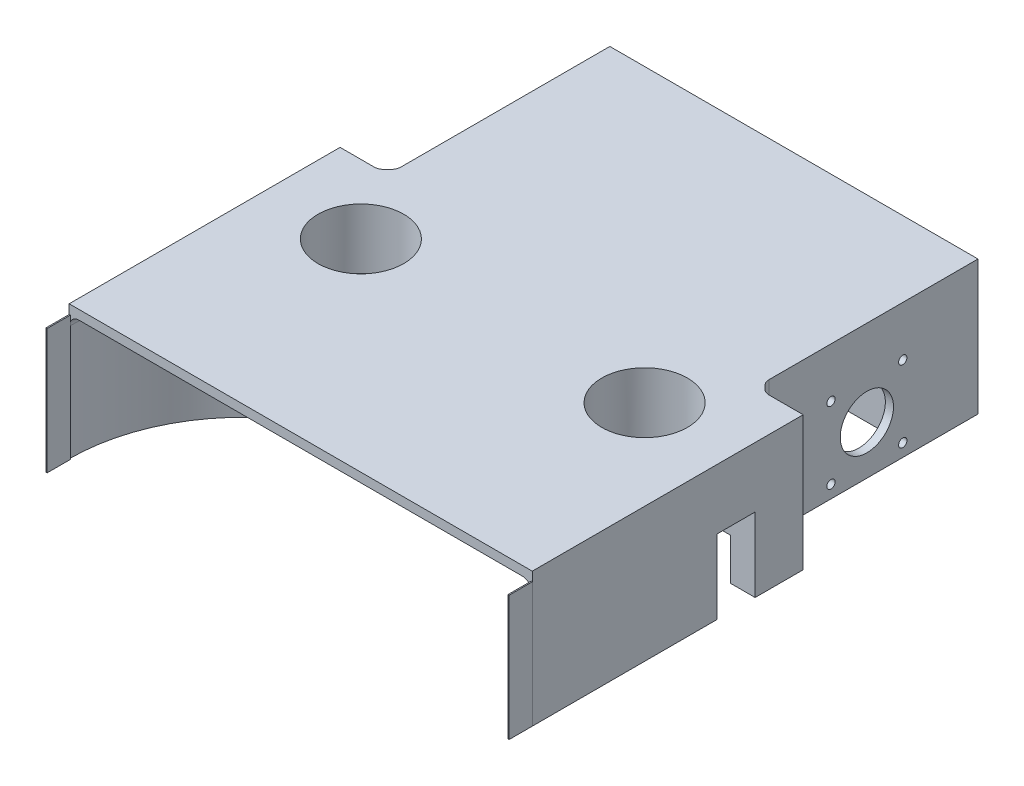
from build123d import *

# Parameters (mm, degrees)
SKETCH_1_W              = 200
SKETCH_1_H              = 213
EXTRUDE_1_DEPTH         = 4
EXTRUDE_2_DEPTH         = 54
SKETCH_1_5_W            = 0.5
SKETCH_1_5_H            = 10
EXTRUDE_3_DEPTH         = 54
EXTRUDE_3_2_DEPTH       = 54
CUT_EXTRUDE_2_DEPTH     = 298.880848663
CUT_EXTRUDE_3_DEPTH     = 42
SKETCH_7_R              = 1.8
SKETCH_7_R_2            = 11.5
CUT_EXTRUDE_4_DEPTH     = 282.53330176
MIRROR_START            = 176
MIRROR_1_OUTLINE_R      = 1.8
MIRROR_1_OUTLINE_R_2    = 11.5
MIRROR_1_DEPTH          = 3.5
CUT_EXTRUDE_START       = -21
CUT_EXTRUDE_5_OUTLINE_W = 27
CUT_EXTRUDE_5_OUTLINE_H = 20
CUT_EXTRUDE_5_DEPTH     = 21
CUT_EXTRUDE_START_2     = -6
CUT_EXTRUDE_6_OUTLINE_W = 27
CUT_EXTRUDE_6_OUTLINE_H = 28
CUT_EXTRUDE_6_DEPTH     = 6
SKETCH_11_R             = 34
CUT_EXTRUDE_7_DEPTH     = 18
CUT_EXTRUDE_8_DEPTH     = 32
SKETCH_15_R             = 18.5
CUT_EXTRUDE_11_DEPTH    = 26
SKETCH_17_R             = 1.5
CUT_EXTRUDE_14_DEPTH    = 295.905069472
CHAMFER_1_SIZE          = 4
FILLET_3_R              = 4.4


# Read off the part's stored shape, not the designer's step: 镜向1, 切除-拉伸5, 切除-拉伸6
with BuildPart() as part:
    # 草图1 → 凸台-拉伸1 (new body)
    with BuildSketch(Plane(origin=(0, 0, 0), x_dir=(1, 0, 0), z_dir=(0, 1, 0))):
        with Locations((100, 106.5)):
            Rectangle(SKETCH_1_W, SKETCH_1_H)
    extrude(amount=EXTRUDE_1_DEPTH)

    # 草图1<4> → 凸台-拉伸2 (add)
    with BuildSketch(Plane(origin=(0, 0, 0), x_dir=(1, 0, 0), z_dir=(0, 1, 0))):
        with BuildLine():
            Line((0, 213), (0, 0))
            ThreePointArc((0, 0), (21.966991411, 53.033008589), (75, 75))
            Line((75, 75), (75, 213))
            Line((75, 213), (0, 213))
        make_face()
        with BuildLine():
            Line((125, 213), (125, 75))
            ThreePointArc((125, 75), (178.033008589, 53.033008589), (200, 0))
            Line((200, 0), (200, 213))
            Line((200, 213), (125, 213))
        make_face()
    extrude(amount=-EXTRUDE_2_DEPTH)

    # 草图3 → 切除-拉伸2 (cut, through all)
    with BuildSketch(Plane.XZ.offset(54)):
        Polygon((20.5, -186), (20.5, -165), (20.5, -144), (20.5, -117), (0, -117), (0, -213), (20.5, -213), align=None)
        Polygon((179.5, -117), (200, -117), (200, -213), (179.5, -213), (179.5, -165), align=None)
    extrude(amount=-CUT_EXTRUDE_2_DEPTH, mode=Mode.SUBTRACT)

    # 草图5 → 切除-拉伸3 (cut)
    with BuildSketch(Plane.XZ.offset(54)):
        Polygon((176, -165), (176, -144), (125, -144), (125, -186), (176, -186), align=None)
        Polygon((24, -165), (24, -144), (75, -144), (75, -186), (24, -186), align=None)
    extrude(amount=-CUT_EXTRUDE_3_DEPTH, mode=Mode.SUBTRACT)

    # 草图7 → 切除-拉伸4 (cut, through all)
    with BuildSketch(Plane(origin=(24, 0, 0), x_dir=(0, 0, -1), z_dir=(1, 0, 0))):
        with Locations((180.5, -17.5)):
            Circle(SKETCH_7_R)
        with Locations((149.5, -17.5)):
            Circle(SKETCH_7_R)
        with Locations((165, -33)):
            Circle(SKETCH_7_R_2)
        with Locations((180.5, -48.5)):
            Circle(SKETCH_7_R)
        with Locations((149.5, -48.5)):
            Circle(SKETCH_7_R)
    extrude(amount=-CUT_EXTRUDE_4_DEPTH, mode=Mode.SUBTRACT)

    # 镜向1 outline → 镜向1 (cut)
    with BuildSketch(Plane.YZ.offset(MIRROR_START)):
        with Locations((-17.5, -180.5)):
            Circle(MIRROR_1_OUTLINE_R)
        with Locations((-17.5, -149.5)):
            Circle(MIRROR_1_OUTLINE_R)
        with Locations((-33, -165)):
            Circle(MIRROR_1_OUTLINE_R_2)
        with Locations((-48.5, -180.5)):
            Circle(MIRROR_1_OUTLINE_R)
        with Locations((-48.5, -149.5)):
            Circle(MIRROR_1_OUTLINE_R)
    extrude(amount=MIRROR_1_DEPTH, mode=Mode.SUBTRACT)

    # 切除-拉伸5 outline → 切除-拉伸5 (cut)
    with BuildSketch(Plane(origin=(75, 0, 0), x_dir=(0, 0, -1), z_dir=(1, 0, 0)).offset(CUT_EXTRUDE_START)):
        with Locations((199.5, -33)):
            Rectangle(CUT_EXTRUDE_5_OUTLINE_W, CUT_EXTRUDE_5_OUTLINE_H)
    extrude(amount=CUT_EXTRUDE_5_DEPTH, mode=Mode.SUBTRACT)

    # 切除-拉伸6 outline → 切除-拉伸6 (cut)
    with BuildSketch(Plane.ZY.offset(-125).offset(CUT_EXTRUDE_START_2)):
        with Locations((-199.5, -33)):
            Rectangle(CUT_EXTRUDE_6_OUTLINE_W, CUT_EXTRUDE_6_OUTLINE_H)
    extrude(amount=CUT_EXTRUDE_6_DEPTH, mode=Mode.SUBTRACT)

    # 草图11 → 切除-拉伸7 (cut)
    with BuildSketch(Plane.XZ.offset(54)):
        with Locations((43.588095895, -88.0112367)):
            Circle(SKETCH_11_R)
        with Locations((156.411904105, -88.0112367)):
            Circle(SKETCH_11_R)
    extrude(amount=-CUT_EXTRUDE_7_DEPTH, mode=Mode.SUBTRACT)

    # 草图12 → 切除-拉伸8 (cut)
    with BuildSketch(Plane.XZ.offset(54)):
        with BuildLine():
            Line((43.588095895, -79.776603565), (0, -79.776603565))
            Line((0, -79.776603565), (0, -96.245869836))
            Line((0, -96.245869836), (43.588095895, -96.245869836))
            ThreePointArc((43.588095895, -96.245869836), (51.82272903, -88.0112367), (43.588095895, -79.776603565))
        make_face()
        with BuildLine():
            Line((200, -79.776603565), (200, -96.245869836))
            Line((200, -96.245869836), (156.411904105, -96.245869836))
            ThreePointArc((156.411904105, -96.245869836), (148.17727097, -88.0112367), (156.411904105, -79.776603565))
            Line((156.411904105, -79.776603565), (200, -79.776603565))
        make_face()
    extrude(amount=-CUT_EXTRUDE_8_DEPTH, mode=Mode.SUBTRACT)

    # 草图15 → 切除-拉伸11 (cut)
    with BuildSketch(Plane(origin=(0, 4, 0), x_dir=(1, 0, 0), z_dir=(0, 1, 0))):
        with Locations(Location((38.73585496, 87.245869836, 0), (0, 0, 270))):
            Circle(SKETCH_15_R)
        with Locations(Location((161.26414504, 87.245869836, 0), (0, 0, 336.187548677))):
            Circle(SKETCH_15_R)
    extrude(amount=-CUT_EXTRUDE_11_DEPTH, mode=Mode.SUBTRACT)

    # 草图17 → 切除-拉伸14 (cut, through all)
    with BuildSketch(Plane.XZ.offset(36)):
        with Locations((25.312461201, -79.495869836)):
            Circle(SKETCH_17_R)
        with Locations(Location((38.73585496, -71.745869836, 0), (0, 0, 270))):
            Circle(SKETCH_17_R)
        with Locations(Location((52.159248718, -79.495869836, 0), (0, 0, 270))):
            Circle(SKETCH_17_R)
        with Locations(Location((52.159248718, -94.995869836, 0), (0, 0, 270))):
            Circle(SKETCH_17_R)
        with Locations(Location((38.73585496, -102.745869836, 0), (0, 0, 270))):
            Circle(SKETCH_17_R)
        with Locations((25.312461201, -94.995869836)):
            Circle(SKETCH_17_R)
        with Locations((174.687538799, -94.995869836)):
            Circle(SKETCH_17_R)
        with Locations(Location((161.26414504, -102.745869836, 0), (0, 0, 270))):
            Circle(SKETCH_17_R)
        with Locations(Location((147.840751282, -94.995869836, 0), (0, 0, 270))):
            Circle(SKETCH_17_R)
        with Locations(Location((147.840751282, -79.495869836, 0), (0, 0, 270))):
            Circle(SKETCH_17_R)
        with Locations(Location((161.26414504, -71.745869836, 0), (0, 0, 270))):
            Circle(SKETCH_17_R)
        with Locations((174.687538799, -79.495869836)):
            Circle(SKETCH_17_R)
    extrude(amount=-CUT_EXTRUDE_14_DEPTH, mode=Mode.SUBTRACT)

    # 倒角1
    chamfer_1_edges = [part.edges().sort_by_distance(p)[0] for p in [
        (20.5, -25, -117),
        (179.5, -25, -117),
    ]]
    chamfer(chamfer_1_edges, length=CHAMFER_1_SIZE)

    # 圆角3
    fillet_3_edges = [part.edges().sort_by_distance(p)[0] for p in [
        (125, -18, -75),
        (125, -45, -101.022473401),
        (75, -18, -75),
        (27.512880617, -45, -58.051472787),
        (75, -45, -101.022473401),
        (172.487119383, -45, -58.051472787),
        (21.966991411, 0, -53.033008589),
        (75, 0, -144),
        (178.033008589, 0, -53.033008589),
        (125, 0, -144),
        (16.5, -25, -117),
        (20.5, -25, -121),
        (179.5, -25, -121),
        (183.5, -25, -117),
    ]]
    fillet(fillet_3_edges, radius=FILLET_3_R)


with BuildPart() as body_2:
    # 草图1<5> → 凸台-拉伸3 (new body)
    with BuildSketch(Plane(origin=(0, 0, 0), x_dir=(1, 0, 0), z_dir=(0, 1, 0))):
        with Locations((199.75, -5)):
            Rectangle(SKETCH_1_5_W, SKETCH_1_5_H)
    extrude(amount=-EXTRUDE_3_DEPTH)


with BuildPart() as body_3:
    # 草图1<5> → Extrude 3 2 (new body)
    with BuildSketch(Plane(origin=(0, 0, 0), x_dir=(1, 0, 0), z_dir=(0, 1, 0))):
        with Locations((0.25, -5)):
            Rectangle(SKETCH_1_5_W, SKETCH_1_5_H)
    extrude(amount=-EXTRUDE_3_2_DEPTH)


solid = Compound([part.part, body_2.part, body_3.part])
